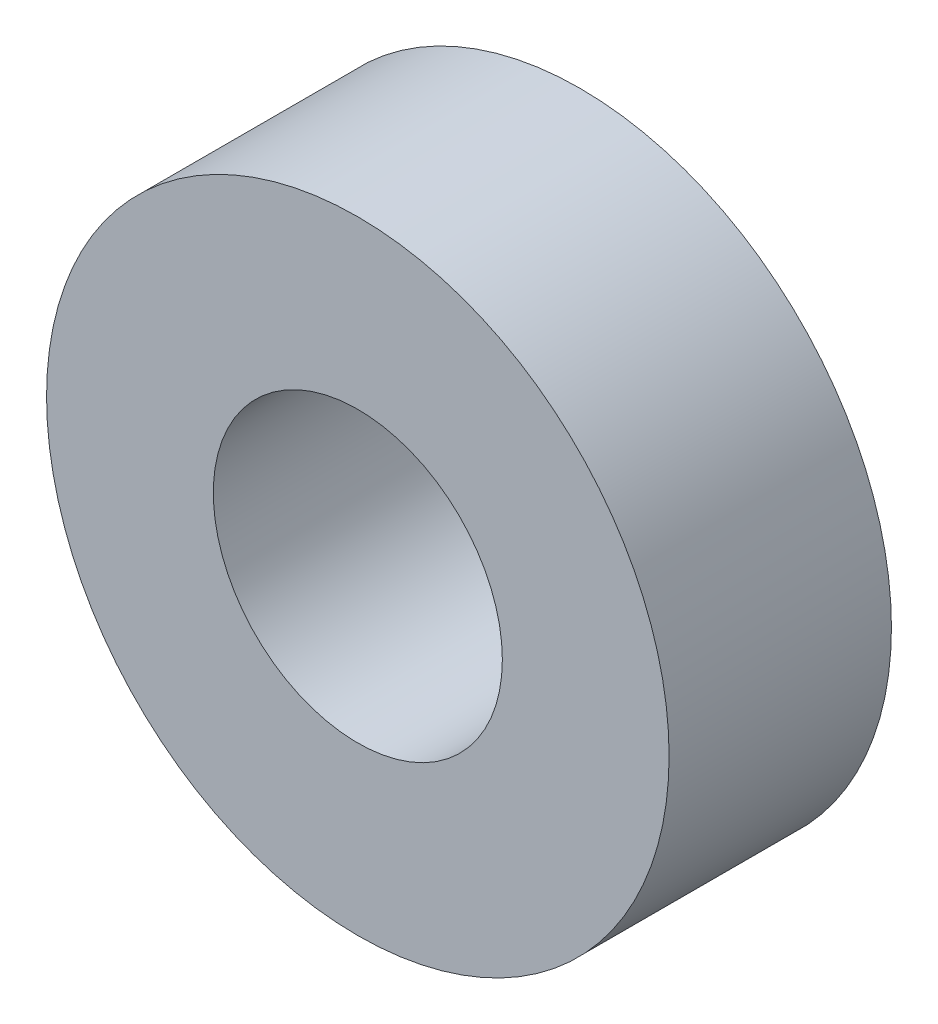
from build123d import *

# Parameters (mm, degrees)
ESQUISSE1_R        = 7
ESQUISSE1_R_2      = 3.25
BOSS_EXTRU_1_DEPTH = 5


with BuildPart() as part:
    # Esquisse1 → Boss.-Extru.1 (new body)
    with BuildSketch(Plane.XY):
        Circle(ESQUISSE1_R)
        Circle(ESQUISSE1_R_2, mode=Mode.SUBTRACT)
    extrude(amount=BOSS_EXTRU_1_DEPTH)


solid = part.part
